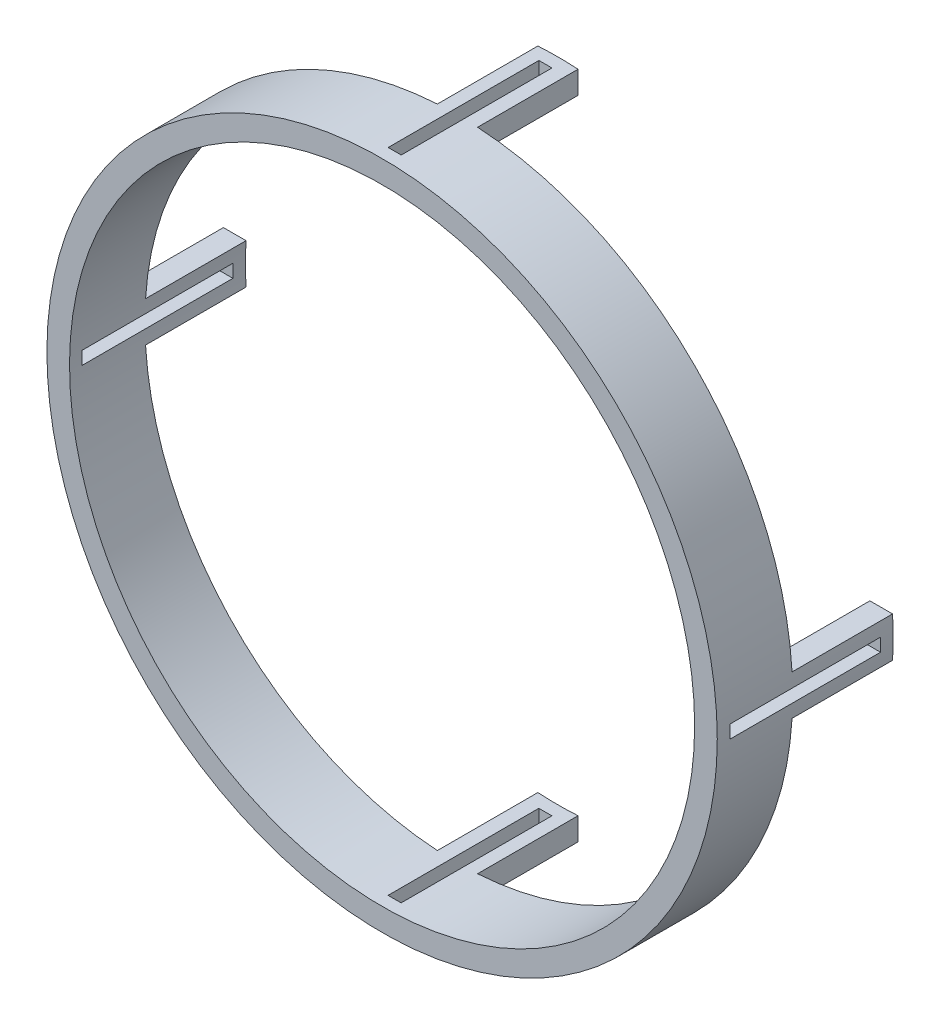
from build123d import *
from build123d.topology import SkipClean

# Parameters (mm, degrees)
SKETCH1_R           = 84.709
SKETCH1_R_2         = 78.994
BOSS_EXTRUDE1_DEPTH = 19.05
BOSS_EXTRUDE2_START = 25.4
BOSS_EXTRUDE2_DEPTH = 25.4
SKETCH2_W           = 3.302
SKETCH2_H           = 38.1
CUT_EXTRUDE1_DEPTH  = 123.459745884
CIRPATTERN1_COUNT   = 4


with BuildPart() as part:
    # Sketch1 → Boss-Extrude1 (new body)
    with BuildSketch(Plane.XY):
        Circle(SKETCH1_R)
        Circle(SKETCH1_R_2, mode=Mode.SUBTRACT)
    extrude(amount=BOSS_EXTRUDE1_DEPTH)

    # Sketch3 → Boss-Extrude2 (add)
    with SkipClean():  # the faces are left unmerged after this step: merging them gives an invalid solid
        with BuildSketch(Plane(origin=(0, 0, 0), x_dir=(-1, 0, 0), z_dir=(0, 0, -1)).offset(BOSS_EXTRUDE2_START)):
            with BuildLine():
                Line((-5.08, 78.830486717), (-5.08, 84.556538961))
                ThreePointArc((-5.08, 84.556538961), (0, 84.709), (5.08, 84.556538961))
                Line((5.08, 84.556538961), (5.08, 78.830486717))
                ThreePointArc((5.08, 78.830486717), (0, 78.994), (-5.08, 78.830486717))
            make_face()
            with BuildLine():
                Line((-5.08, -78.830486717), (-5.08, -84.556538961))
                ThreePointArc((-5.08, -84.556538961), (0, -84.709), (5.08, -84.556538961))
                Line((5.08, -84.556538961), (5.08, -78.830486717))
                ThreePointArc((5.08, -78.830486717), (0, -78.994), (-5.08, -78.830486717))
            make_face()
            with BuildLine():
                Line((78.830486717, -5.08), (84.556538961, -5.08))
                ThreePointArc((84.556538961, -5.08), (84.709, 0), (84.556538961, 5.08))
                Line((84.556538961, 5.08), (78.830486717, 5.08))
                ThreePointArc((78.830486717, 5.08), (78.994, 0), (78.830486717, -5.08))
            make_face()
            with BuildLine():
                Line((-78.830486717, 5.08), (-84.556538961, 5.08))
                ThreePointArc((-84.556538961, 5.08), (-84.709, 0), (-84.556538961, -5.08))
                Line((-84.556538961, -5.08), (-78.830486717, -5.08))
                ThreePointArc((-78.830486717, -5.08), (-78.994, 0), (-78.830486717, 5.08))
            make_face()
        extrude(amount=-BOSS_EXTRUDE2_DEPTH)

    # Sketch2 → Cut-Extrude1 (cut, through all)
    with SkipClean():  # the faces are left unmerged after this step: merging them gives an invalid solid
        with BuildSketch(Plane(origin=(0, 0, 0), x_dir=(1, 0, 0), z_dir=(0, 1, 0))):
            with Locations((0, 3.175)):
                Rectangle(SKETCH2_W, SKETCH2_H)
        cut_extrude1 = extrude(amount=-CUT_EXTRUDE1_DEPTH, mode=Mode.SUBTRACT)

    # CirPattern1: Cut-Extrude1 ×4 about axis
    with SkipClean():  # the faces are left unmerged after this step: merging them gives an invalid solid
        cirpattern1_axis = Axis((0, 0, 2.080715754), (0, 0, 1))
        for i in range(1, CIRPATTERN1_COUNT):
            add(cut_extrude1.rotate(cirpattern1_axis, i * 360 / CIRPATTERN1_COUNT), mode=Mode.SUBTRACT)


solid = part.part
